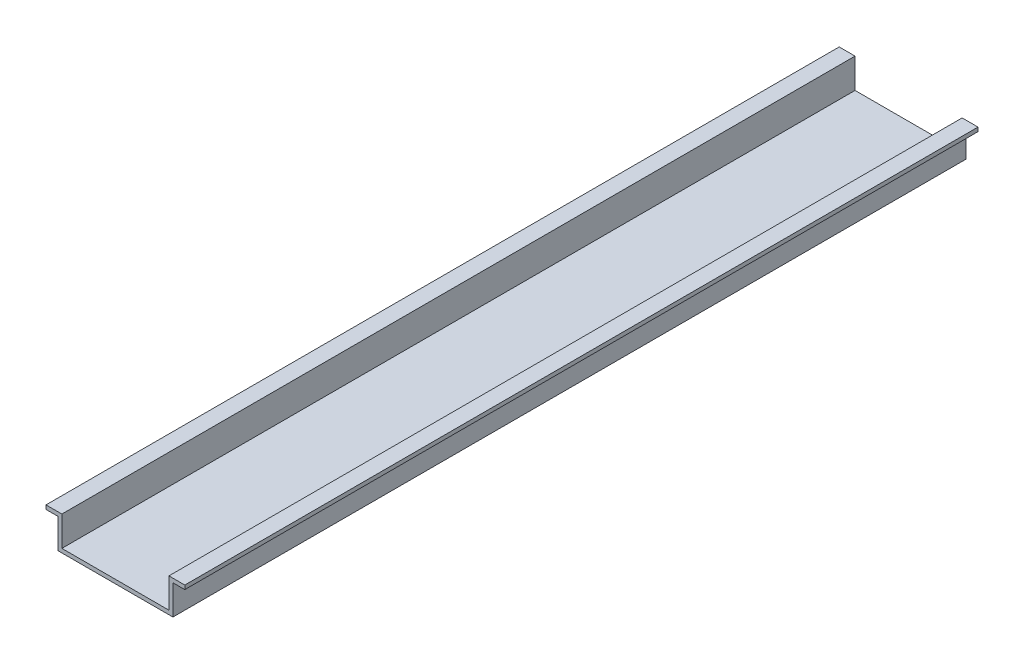
from build123d import *

# Parameters (mm, degrees)
EXTRUDE_THIN1_DEPTH = 100


with BuildPart() as part:
    # Sketch1 → Extrude-Thin1 (new, symmetric)
    with BuildSketch(Plane.XY):
        Polygon((17.5, 7.5), (13.5, 7.5), (13.5, 0), (-13.5, 0), (-13.5, 7.5), (-17.5, 7.5), (-17.5, 6.5), (-14.5, 6.5), (-14.5, -1), (14.5, -1), (14.5, 6.5), (17.5, 6.5), align=None)
    extrude(amount=EXTRUDE_THIN1_DEPTH, both=True)


solid = part.part
